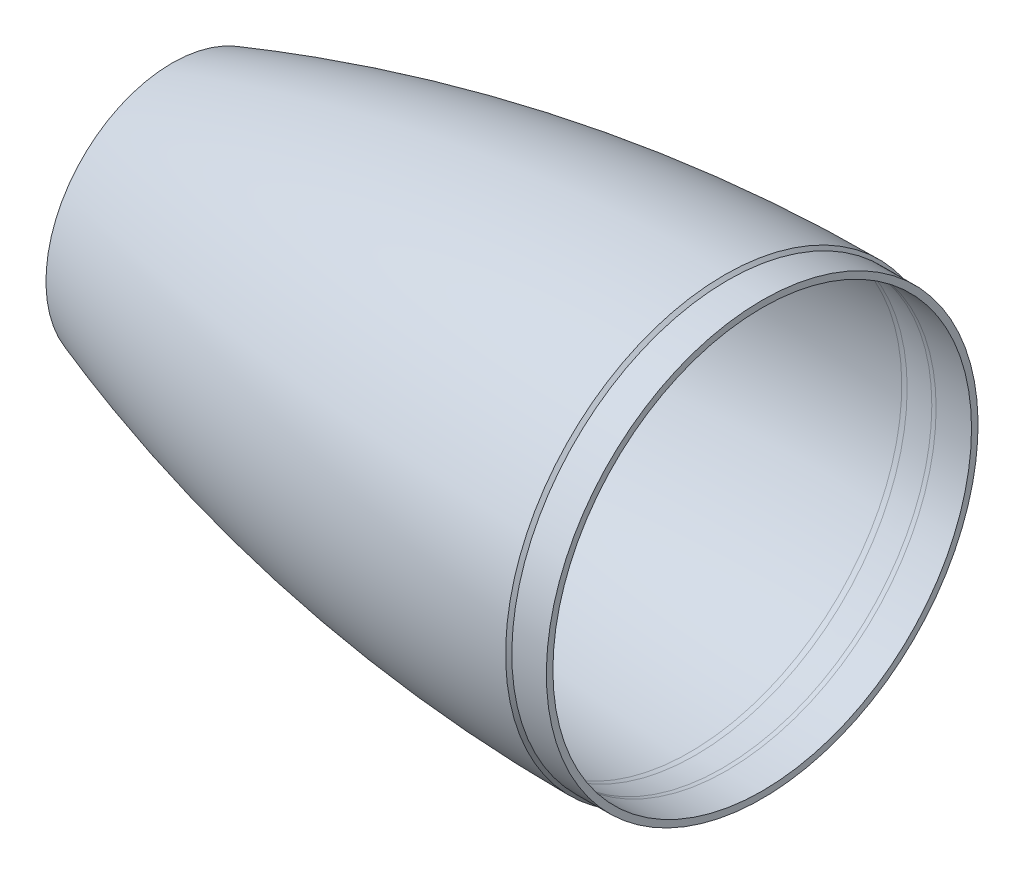
from build123d import *


with BuildPart() as part:
    # Sketch1 → Revolve1 (revolve)
    with BuildSketch(Plane.XY):
        with BuildLine():
            Line((-203.2, 46.355), (-203.2, 41.4655))
            Line((-203.2, 41.4655), (-183.754587886, 41.4655))
            ThreePointArc((-183.754587886, 41.4655), (-178.071177239, 42.333053976), (-172.905421762, 44.856697542))
            Line((-172.905421762, 44.856697542), (-157.174655244, 55.755723803))
            ThreePointArc((-157.174655244, 55.755723803), (-152.112106925, 58.615583027), (-146.612916839, 60.504259459))
            ThreePointArc((-146.612916839, 60.504259459), (-80.194180108, 72.901209652), (-12.819958692, 77.985228898))
            ThreePointArc((-12.819958692, 77.985228898), (-11.791604784, 77.978768405), (-10.765097896, 77.916824028))
            Line((-10.765097896, 77.916824028), (-0.828575937, 77.047491001))
            ThreePointArc((-0.828575937, 77.047491001), (0.000791633, 76.993131379), (0.831740962, 76.975))
            Line((0.831740962, 76.975), (13.843, 76.975))
            Line((13.843, 76.975), (13.843, 79.375))
            Line((13.843, 79.375), (1.143, 79.375))
            Line((1.143, 79.375), (0, 80.518))
            ThreePointArc((0, 80.518), (-103.025907626, 71.917734953), (-203.2, 46.355))
        make_face()
    revolve(axis=Axis((0, 0, 0), (-1, 0, 0)))


solid = part.part
